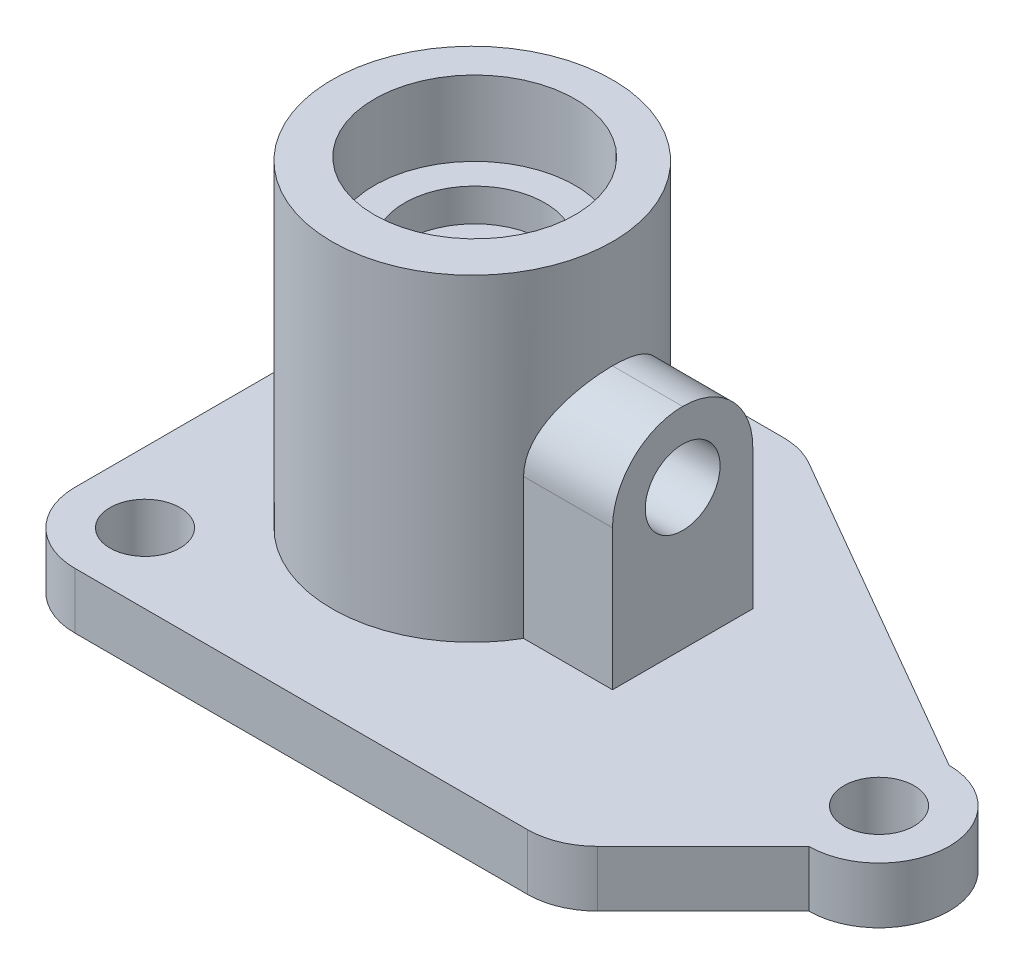
from build123d import *

# Parameters (mm, degrees)
SKETCH2_R           = 7.5
BOSS_EXTRUDE3_DEPTH = 6
SKETCH4_R           = 30
BOSS_EXTRUDE6_DEPTH = 68
SKETCH5_R           = 15
CUT_EXTRUDE1_DEPTH  = 205.939015319
SKETCH6_R           = 21.472161424
CUT_EXTRUDE3_DEPTH  = 16
BOSS_EXTRUDE7_DEPTH = 45
FILLET2_R           = 15
SKETCH9_R           = 8
CUT_EXTRUDE8_DEPTH  = 17.5


with BuildPart() as part:
    # Sketch2 → Boss-Extrude3 (new, symmetric)
    with BuildSketch(Plane(origin=(0, 0, 0), x_dir=(1, 0, 0), z_dir=(0, 1, 0))):
        with BuildLine():
            Line((0, 15), (0, 85))
            ThreePointArc((0, 85), (4.393398282, 95.606601718), (15, 100))
            Line((15, 100), (66.502577388, 100))
            ThreePointArc((66.502577388, 100), (70.384863065, 99.488887394), (74.002577388, 97.990381057))
            Line((74.002577388, 97.990381057), (145, 57))
            ThreePointArc((145, 57), (160, 42), (145, 27))
            Line((145, 27), (122.393398282, 4.393398282))
            ThreePointArc((122.393398282, 4.393398282), (117.52704805, 1.141807012), (111.786796564, 0))
            Line((111.786796564, 0), (15, 0))
            ThreePointArc((15, 0), (4.393398282, 4.393398282), (0, 15))
        make_face()
        with Locations(Location((145, 42, 0), (0, 0, 270))):
            Circle(SKETCH2_R, mode=Mode.SUBTRACT)
        with Locations(Location((15, 85, 0), (0, 0, 270))):
            Circle(SKETCH2_R, mode=Mode.SUBTRACT)
        with Locations(Location((15, 15, 0), (0, 0, 270))):
            Circle(SKETCH2_R, mode=Mode.SUBTRACT)
    extrude(amount=BOSS_EXTRUDE3_DEPTH, both=True)

    # Sketch4 → Boss-Extrude6 (add)
    with BuildSketch(Plane(origin=(0, 6, 0), x_dir=(1, 0, 0), z_dir=(0, 1, 0))):
        with Locations(Location((50, 50, 0), (0, 0, 90))):
            Circle(SKETCH4_R)
    extrude(amount=BOSS_EXTRUDE6_DEPTH)

    # Sketch5 → Cut-Extrude1 (cut, through all)
    with BuildSketch(Plane(origin=(0, 74, 0), x_dir=(1, 0, 0), z_dir=(0, 1, 0))):
        with Locations(Location((49.557906347, 50.967812226, 0), (0, 0, 270))):
            Circle(SKETCH5_R)
    extrude(amount=-CUT_EXTRUDE1_DEPTH, mode=Mode.SUBTRACT)

    # Sketch6 → Cut-Extrude3 (cut)
    with BuildSketch(Plane(origin=(0, 74, 0), x_dir=(1, 0, 0), z_dir=(0, 1, 0))):
        with Locations(Location((49.557906347, 50.967812226, 0), (0, 0, 270))):
            Circle(SKETCH6_R)
    extrude(amount=-CUT_EXTRUDE3_DEPTH, mode=Mode.SUBTRACT)

    # Sketch8 → Boss-Extrude7 (add)
    with BuildSketch(Plane(origin=(0, 6, 0), x_dir=(1, 0, 0), z_dir=(0, 1, 0))):
        with BuildLine():
            Line((75.980762114, 65), (95, 65))
            Line((95, 65), (95, 50))
            Line((95, 50), (95, 35))
            Line((95, 35), (75.980762114, 35))
            ThreePointArc((75.980762114, 35), (20, 50), (75.980762114, 65))
        make_face()
    extrude(amount=BOSS_EXTRUDE7_DEPTH)

    # Fillet2
    # the kernel refuses this fillet: 15 mm, written as the material it takes off along each edge
    with BuildSketch(Plane(origin=(38.480762114, 51, -65), x_dir=(0, 0, 1), z_dir=(1, 0, 0))) as fillet2_piece_1_section:
        with BuildLine():
            CenterArc((FILLET2_R, FILLET2_R), FILLET2_R, 180, 90)
            Line((0, FILLET2_R), (0, 0))
            Line((0, 0), (FILLET2_R, 0))
        make_face()
    fillet2_piece_1 = extrude(amount=94.019237886, mode=Mode.PRIVATE)
    fillet2_piece_1 = fillet2_piece_1 - Plane(origin=(50, 47.545700525, -50), x_dir=(0, 0, -1), z_dir=(0, -1, 0)) * Cylinder(30, 249, mode=Mode.PRIVATE)
    add(fillet2_piece_1, mode=Mode.SUBTRACT)
    with BuildSketch(Plane(origin=(132.5, 51, -35), x_dir=(0, -1, 0), z_dir=(-1, 0, 0))) as fillet2_piece_2_section:
        with BuildLine():
            CenterArc((FILLET2_R, -FILLET2_R), FILLET2_R, 90, 90)
            Line((0, -FILLET2_R), (0, 0))
            Line((0, 0), (FILLET2_R, 0))
        make_face()
    fillet2_piece_2 = extrude(amount=94.019237886, mode=Mode.PRIVATE)
    fillet2_piece_2 = fillet2_piece_2 - Plane(origin=(50, 47.545704386, -50), x_dir=(0, 0, -1), z_dir=(0, -1, 0)) * Cylinder(30, 249, mode=Mode.PRIVATE)
    add(fillet2_piece_2, mode=Mode.SUBTRACT)

    # Sketch9 → Cut-Extrude8 (cut, symmetric)
    with BuildSketch(Plane(origin=(95, 0, 0), x_dir=(0, 0, -1), z_dir=(1, 0, 0))):
        with Locations((50, 36)):
            Circle(SKETCH9_R)
    extrude(amount=CUT_EXTRUDE8_DEPTH, both=True, mode=Mode.SUBTRACT)


solid = part.part
